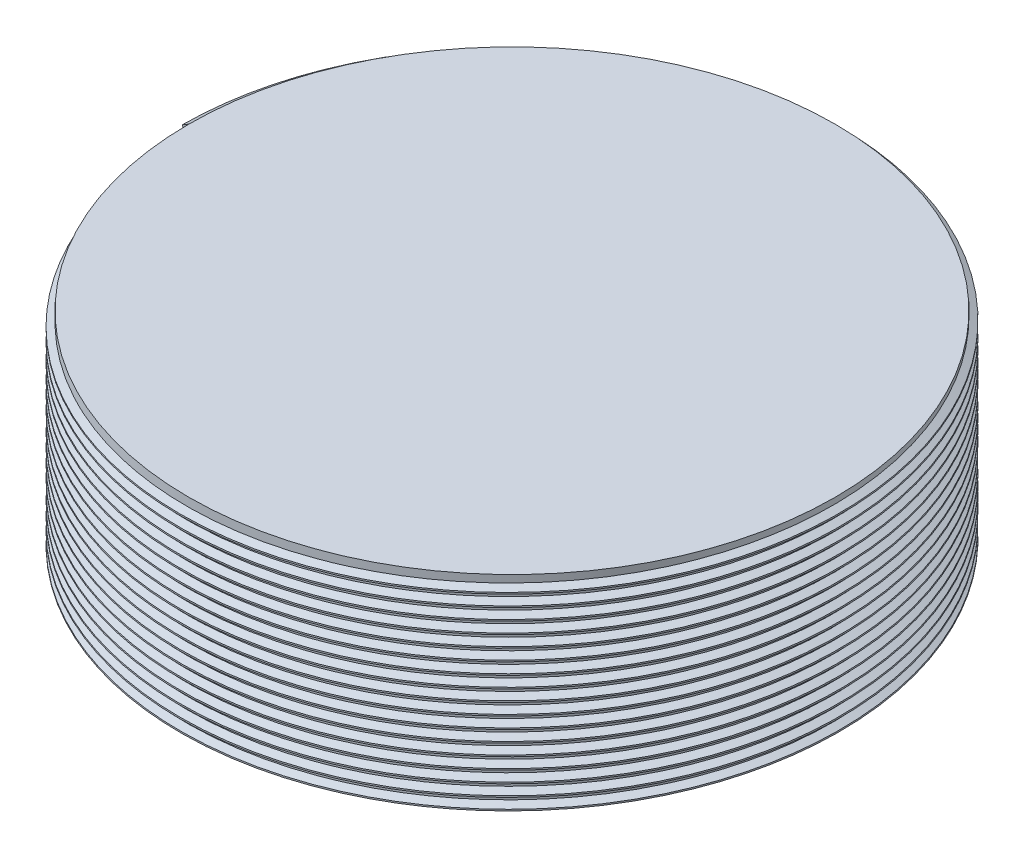
from build123d import *
from build123d.topology import SkipClean

# Parameters (mm, degrees)
SKETCH1_R                     = 20.65
BOSS_EXTRUDE1_DEPTH           = 12.7
MINCOLWIDTH_ONTRACKING1_PITCH = 0.75


with BuildPart() as part:
    # Sketch1 → Boss-Extrude1 (new body)
    with BuildSketch(Plane(origin=(0, 0, 0), x_dir=(1, 0, 0), z_dir=(0, 1, 0))):
        with Locations(Location((0, 0, 0), (0, 0, 270))):
            Circle(SKETCH1_R)
    extrude(amount=BOSS_EXTRUDE1_DEPTH)

    # MinColWidth_OnTracking1: the profile of HeaderRowsCount1 profile screwed along a right-hand helix of 17.333333 turns, 8 arcs to a turn; built about Z, then put on its axis
    with SkipClean():  # the faces are left unmerged after this step: merging them gives an invalid solid
        mincolwidth_ontracking1_z = Axis((0, 0, 0), (0, 0, 1))
        mincolwidth_ontracking1_corners = [(20.6497, 0, -0.000173205), (21.05595, 0, 0.234375342), (21.05595, 0, 0.328125342), (20.6497, 0, 0.562673889)]
        with BuildLine(mode=Mode.PRIVATE) as mincolwidth_ontracking1_profile:
            Line(mincolwidth_ontracking1_corners[0], mincolwidth_ontracking1_corners[1])
            Line(mincolwidth_ontracking1_corners[1], mincolwidth_ontracking1_corners[2])
            Line(mincolwidth_ontracking1_corners[2], mincolwidth_ontracking1_corners[3])
            Line(mincolwidth_ontracking1_corners[3], mincolwidth_ontracking1_corners[0])
        mincolwidth_ontracking1_cap = Face(mincolwidth_ontracking1_profile.wire())
        mincolwidth_ontracking1_turn_angles = [0, 22.5, 45, 67.5, 90, 112.5, 135, 157.5, 180, 202.5, 225, 247.5, 270, 292.5, 315, 337.5, 360]
        mincolwidth_ontracking1_turn_weights = [1, 0.9238795325112867, 1, 0.9238795325112867, 1, 0.9238795325112867, 1, 0.9238795325112867, 1, 0.9238795325112867, 1, 0.9238795325112867, 1, 0.9238795325112867, 1, 0.9238795325112867, 1]
        mincolwidth_ontracking1_turn_rails = [Edge.make_bspline([Vector(p[0], p[1], 0).rotate(mincolwidth_ontracking1_z, mincolwidth_ontracking1_turn_angles[k]) / mincolwidth_ontracking1_turn_weights[k] + Vector(0, 0, p[2] + MINCOLWIDTH_ONTRACKING1_PITCH * mincolwidth_ontracking1_turn_angles[k] / 360) for k in range(17)], [0, 0, 0, 1, 1, 2, 2, 3, 3, 4, 4, 5, 5, 6, 6, 7, 7, 8, 8, 8], 2, mincolwidth_ontracking1_turn_weights) for p in mincolwidth_ontracking1_corners]
        mincolwidth_ontracking1_turn_sides = [Face.make_surface_from_curves(mincolwidth_ontracking1_turn_rails[p[0]], mincolwidth_ontracking1_turn_rails[p[1]]) for p in [(0, 1), (1, 2), (2, 3), (3, 0)]]
        mincolwidth_ontracking1_last_angles = [6120, 6142.5, 6165, 6187.5, 6210, 6225, 6240]
        mincolwidth_ontracking1_last_weights = [1, 0.9238795325112867, 1, 0.9238795325112867, 1, 0.9659258262890683, 1]
        mincolwidth_ontracking1_last_rails = [Edge.make_bspline([Vector(p[0], p[1], 0).rotate(mincolwidth_ontracking1_z, mincolwidth_ontracking1_last_angles[k]) / mincolwidth_ontracking1_last_weights[k] + Vector(0, 0, p[2] + MINCOLWIDTH_ONTRACKING1_PITCH * mincolwidth_ontracking1_last_angles[k] / 360) for k in range(7)], [0, 0, 0, 1, 1, 2, 2, 3, 3, 3], 2, mincolwidth_ontracking1_last_weights) for p in mincolwidth_ontracking1_corners]
        mincolwidth_ontracking1_last_sides = [Face.make_surface_from_curves(mincolwidth_ontracking1_last_rails[p[0]], mincolwidth_ontracking1_last_rails[p[1]]) for p in [(0, 1), (1, 2), (2, 3), (3, 0)]]
        mincolwidth_ontracking1 = Plane(origin=(0, 12.7, 0), x_dir=(-1, 0, 0), z_dir=(0, -1, 0)) * Solid(Shell([*[p.moved(Location((0, 0, MINCOLWIDTH_ONTRACKING1_PITCH * i))) for i in range(17) for p in mincolwidth_ontracking1_turn_sides], *mincolwidth_ontracking1_last_sides, mincolwidth_ontracking1_cap, mincolwidth_ontracking1_cap.rotate(mincolwidth_ontracking1_z, 6240).moved(Location((0, 0, MINCOLWIDTH_ONTRACKING1_PITCH * 6240 / 360)))]))
        add(mincolwidth_ontracking1)


solid = part.part
